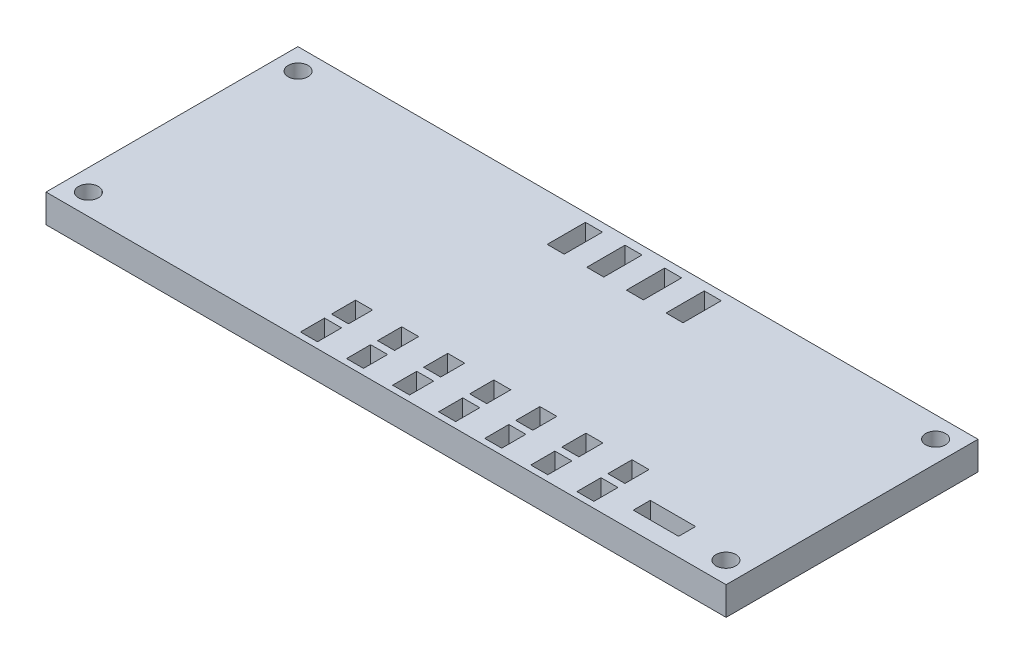
from build123d import *

# Parameters (mm, degrees)
SKETCH_1_W                  = 120.015
SKETCH_1_H                  = 44.45
EXTRUDE_1_DEPTH             = 5
SKETCH_2_R                  = 1.75
CUT_EXTRUDE_4_DEPTH         = 5
MIRROR_2_COPY_1_SKETCH_R    = 1.75
MIRROR_2_COPY_1_DEPTH       = 5
MIRROR_2_COPY_2_SKETCH_R    = 1.75
MIRROR_2_COPY_2_DEPTH       = 5
SKETCH_3_W                  = 3
SKETCH_3_H                  = 4.2499848
CUT_EXTRUDE_5_DEPTH         = 5
PATTERN_LINEAR_1_COUNT      = 7
PATTERN_LINEAR_1_PITCH      = 8.13
PATTERN_LINEAR_1_COUNT_DIR2 = 2
PATTERN_LINEAR_1_PITCH_DIR2 = 5.48
SKETCH_4_W                  = 3
SKETCH_4_H                  = 6.7500052
CUT_EXTRUDE_6_DEPTH         = 5
PATTERN_LINEAR_2_COUNT      = 4
PATTERN_LINEAR_2_PITCH      = 6.99
SKETCH_5_W                  = 7.99999
SKETCH_5_H                  = 3
CUT_EXTRUDE_7_DEPTH         = 5


with BuildPart() as part:
    # 草图1 → 凸台-拉伸1 (new body)
    with BuildSketch(Plane(origin=(0, 0, 0), x_dir=(1, 0, 0), z_dir=(0, 1, 0))):
        Rectangle(SKETCH_1_W, SKETCH_1_H)
    extrude(amount=EXTRUDE_1_DEPTH)

    # 草图2 → 切除-拉伸4 (cut)
    with BuildSketch(Plane(origin=(0, 0, 0), x_dir=(1, 0, 0), z_dir=(0, 1, 0))):
        with Locations((-56.25, 18.5)):
            Circle(SKETCH_2_R)
    cut_extrude_4 = extrude(amount=CUT_EXTRUDE_4_DEPTH, mode=Mode.SUBTRACT)

    # 镜向1: 切除-拉伸4 across plane
    add(cut_extrude_4.mirror(Plane.XY), mode=Mode.SUBTRACT)

    # 镜向2 copy 1 sketch → 镜向2 copy 1 (cut)
    with BuildSketch(Plane(origin=(0, 0, 0), x_dir=(-1, 0, 0), z_dir=(0, 1, 0))):
        with Locations((-56.25, 18.5)):
            Circle(MIRROR_2_COPY_1_SKETCH_R)
    extrude(amount=MIRROR_2_COPY_1_DEPTH, mode=Mode.SUBTRACT)

    # 镜向2 copy 2 sketch → 镜向2 copy 2 (cut)
    with BuildSketch(Plane(origin=(0, 0, 0), x_dir=(-1, 0, 0), z_dir=(0, 1, 0))):
        with Locations((-56.25, -18.5)):
            Circle(MIRROR_2_COPY_2_SKETCH_R)
    extrude(amount=MIRROR_2_COPY_2_DEPTH, mode=Mode.SUBTRACT)

    # 草图3 → 切除-拉伸5 (cut)
    with BuildSketch(Plane(origin=(0, 5, 0), x_dir=(1, 0, 0), z_dir=(0, 1, 0))):
        with Locations((-14.6685, -13.5579612)):
            Rectangle(SKETCH_3_W, SKETCH_3_H)
    cut_extrude_5 = extrude(amount=-CUT_EXTRUDE_5_DEPTH, mode=Mode.SUBTRACT)

    # 阵列(线性)1: Cut-Extrude 5 7 × 2
    with Locations(*[(i * PATTERN_LINEAR_1_PITCH, 0, j * PATTERN_LINEAR_1_PITCH_DIR2) for i in range(PATTERN_LINEAR_1_COUNT) for j in range(PATTERN_LINEAR_1_COUNT_DIR2) if (i, j) != (0, 0)]):
        add(cut_extrude_5, mode=Mode.SUBTRACT)

    # 草图4 → 切除-拉伸6 (cut)
    with BuildSketch(Plane(origin=(0, 5, 0), x_dir=(1, 0, 0), z_dir=(0, 1, 0))):
        with Locations((-6.2865, 17.3690026)):
            Rectangle(SKETCH_4_W, SKETCH_4_H)
    cut_extrude_6 = extrude(amount=-CUT_EXTRUDE_6_DEPTH, mode=Mode.SUBTRACT)

    # 阵列(线性)2: 切除-拉伸6 ×4
    with Locations(*[(i * PATTERN_LINEAR_2_PITCH, 0, 0) for i in range(1, PATTERN_LINEAR_2_COUNT)]):
        add(cut_extrude_6, mode=Mode.SUBTRACT)

    # 草图5 → 切除-拉伸7 (cut)
    with BuildSketch(Plane(origin=(0, 5, 0), x_dir=(1, 0, 0), z_dir=(0, 1, 0))):
        with Locations((44.426505, -17.526)):
            Rectangle(SKETCH_5_W, SKETCH_5_H)
    extrude(amount=-CUT_EXTRUDE_7_DEPTH, mode=Mode.SUBTRACT)


solid = part.part
